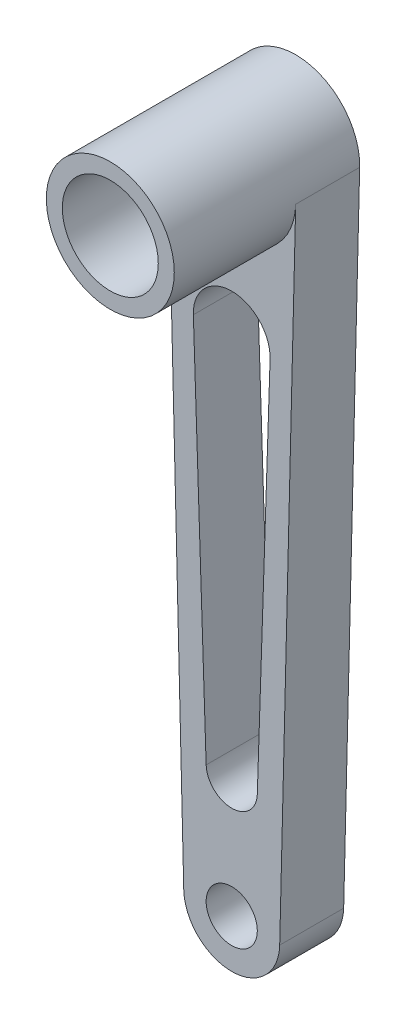
from build123d import *

# Parameters (mm, degrees)
SKETCH1_R           = 4
BOSS_EXTRUDE2_DEPTH = 10
SKETCH1_6_R         = 7.5
BOSS_EXTRUDE3_DEPTH = 28.98


with BuildPart() as part:
    # Sketch1 → Boss-Extrude2 (new body)
    with BuildSketch(Plane.XY):
        with BuildLine():
            ThreePointArc((9.996972197, -0.246062766), (5.5e-08, -10), (-9.996972195, -0.246062876))
            Line((-9.996972195, -0.246062876), (-7.497729139, -101.784547426))
            ThreePointArc((-7.497729139, -101.784547426), (1.58e-07, -109.1), (7.497729147, -101.784547111))
            Line((7.497729147, -101.784547111), (9.996972197, -0.246062766))
        make_face()
        with BuildLine():
            Line((5.996665744, -23.199999888), (3.997777167, -83.133333141))
            ThreePointArc((3.997777167, -83.133333141), (1.93e-07, -87), (-3.997777154, -83.133333527))
            Line((-3.997777154, -83.133333527), (-5.996665745, -23.199999845))
            ThreePointArc((-5.996665745, -23.199999845), (2.1e-08, -17), (5.996665744, -23.199999888))
        make_face(mode=Mode.SUBTRACT)
        with Locations((0, -101.6)):
            Circle(SKETCH1_R, mode=Mode.SUBTRACT)
    extrude(amount=BOSS_EXTRUDE2_DEPTH)

    # Sketch1<6> → Boss-Extrude3 (add)
    with BuildSketch(Plane.XY):
        with BuildLine():
            ThreePointArc((10, 0), (-0.123040752, 9.99924302), (-9.996972195, -0.246062876))
            ThreePointArc((-9.996972195, -0.246062876), (5.5e-08, -10), (9.996972197, -0.246062766))
            ThreePointArc((9.996972197, -0.246062766), (9.999243021, -0.123040697), (10, 0))
        make_face()
        Circle(SKETCH1_6_R, mode=Mode.SUBTRACT)
    extrude(amount=BOSS_EXTRUDE3_DEPTH)


solid = part.part
